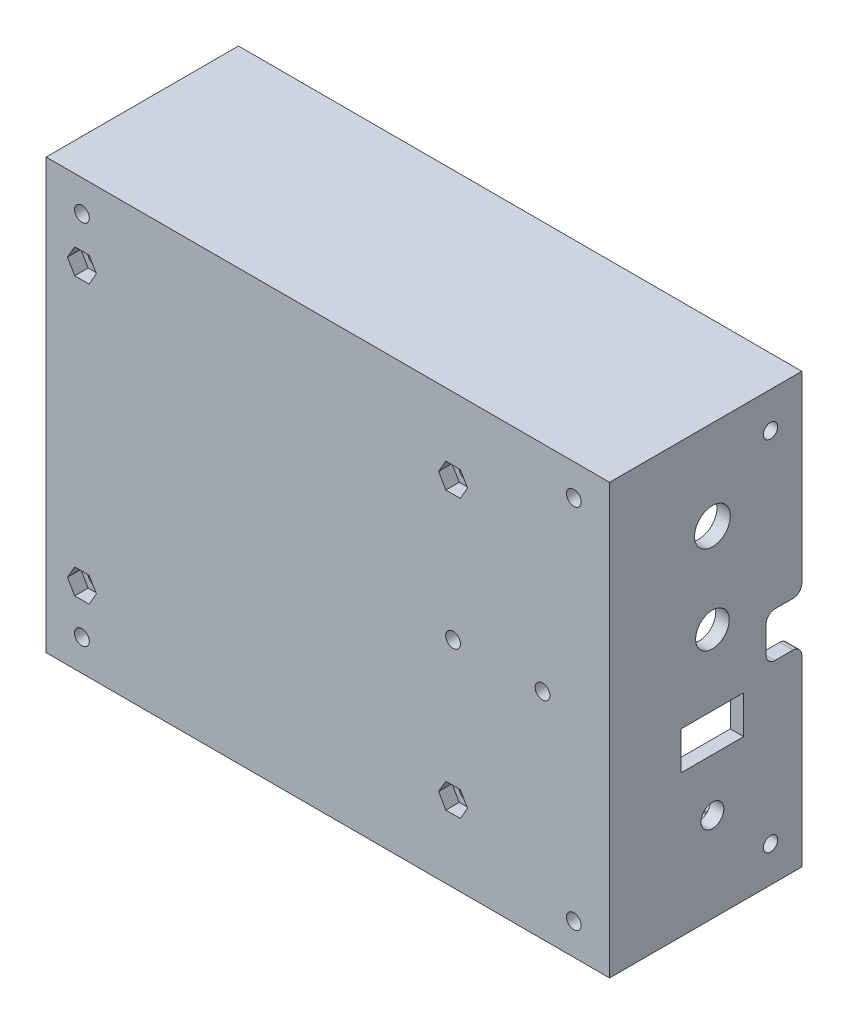
from build123d import *

# Parameters (mm, degrees)
SKETCH1_W            = 120
SKETCH1_H            = 90
SKETCH1_R            = 1.65
BOSS_EXTRUDE2_DEPTH  = 4
SKETCH2_W            = 126
SKETCH2_H            = 96
SKETCH2_W_2          = 120
SKETCH2_H_2          = 90
BOSS_EXTRUDE3_DEPTH  = 43
CUT_EXTRUDE1_REACH   = 142.36
SKETCH3_R            = 1.6
SKETCH4_R            = 3.75
SKETCH4_W            = 8
SKETCH4_H            = 10
SKETCH4_W_2          = 14
SKETCH4_H_2          = 8.5
CUT_EXTRUDE3_DEPTH   = 10
SKETCH5_R            = 4
CUT_EXTRUDE4_DEPTH   = 10
SKETCH6_R            = 2.55
CUT_EXTRUDE5_DEPTH   = 10
SKETCH8_R            = 1.65
CUT_EXTRUDE6_DEPTH   = 10
BOSS_EXTRUDE4_DEPTH  = 3
FILLET1_R            = 2
CUT_EXTRUDE8_DEPTH   = 3
BOSS_EXTRUDE11_START = 5
SKETCH12_R           = 3.5
SKETCH12_R_2         = 1.65
BOSS_EXTRUDE11_DEPTH = 5
SKETCH13_W           = 18
SKETCH13_H           = 16
SKETCH13_W_2         = 12
SKETCH13_H_2         = 12
BOSS_EXTRUDE12_DEPTH = 1
CHAMFER1_SIZE        = 1
SKETCH16_R           = 3.5
CUT_EXTRUDE11_DEPTH  = 3
SKETCH17_W           = 55.5
SKETCH17_H           = 15
CUT_EXTRUDE13_DEPTH  = 2
SKETCH20_W           = 55.5
SKETCH20_H           = 15
CUT_EXTRUDE14_DEPTH  = 2
SKETCH21_W           = 8
SKETCH21_H           = 34.5
SKETCH21_W_2         = 15
SKETCH21_H_2         = 40.5
CUT_EXTRUDE15_DEPTH  = 2
CHAMFER6_SIZE        = 1.5


with BuildPart() as part:
    # Sketch1 → Boss-Extrude2 (new body)
    with BuildSketch(Plane.XY):
        Rectangle(SKETCH1_W, SKETCH1_H)
        with Locations((-55, 31)):
            Circle(SKETCH1_R, mode=Mode.SUBTRACT)
        with Locations((28, 31)):
            Circle(SKETCH1_R, mode=Mode.SUBTRACT)
        with Locations((28, -31)):
            Circle(SKETCH1_R, mode=Mode.SUBTRACT)
        with Locations((-55, -31)):
            Circle(SKETCH1_R, mode=Mode.SUBTRACT)
        with Locations((-55, 41)):
            Circle(SKETCH1_R, mode=Mode.SUBTRACT)
        with Locations((55, 41)):
            Circle(SKETCH1_R, mode=Mode.SUBTRACT)
        with Locations((55, -41)):
            Circle(SKETCH1_R, mode=Mode.SUBTRACT)
        with Locations((-55, -41)):
            Circle(SKETCH1_R, mode=Mode.SUBTRACT)
    extrude(amount=BOSS_EXTRUDE2_DEPTH)

    # Sketch2 → Boss-Extrude3 (add)
    with BuildSketch(Plane.XY.offset(4)):
        Rectangle(SKETCH2_W, SKETCH2_H)
        Rectangle(SKETCH2_W_2, SKETCH2_H_2, mode=Mode.SUBTRACT)
    extrude(amount=-BOSS_EXTRUDE3_DEPTH)

    # Cut-Extrude1: up to this face of the body (flat: up to its plane)
    cut_extrude1_end = Plane(part.part.faces().sort_by_distance((63, 0, -17.5))[0])
    # Sketch3 → Cut-Extrude1 (cut, up to the picked face)
    with BuildSketch(Plane.ZY.offset(63), mode=Mode.PRIVATE) as cut_extrude1_sk1:
        with Locations(Location((-32, -40, 0), (0, 0, 180))):
            Circle(SKETCH3_R)
    cut_extrude1_tool1 = split(extrude(cut_extrude1_sk1.sketch, amount=-CUT_EXTRUDE1_REACH, mode=Mode.PRIVATE), bisect_by=cut_extrude1_end, keep=Keep.BOTH, mode=Mode.PRIVATE)
    # Sketch3 → Cut-Extrude1 (cut, up to the picked face)
    with BuildSketch(Plane.ZY.offset(63), mode=Mode.PRIVATE) as cut_extrude1_sk2:
        with Locations(Location((-32, 40, 0), (0, 0, 180))):
            Circle(SKETCH3_R)
    cut_extrude1_tool2 = split(extrude(cut_extrude1_sk2.sketch, amount=-CUT_EXTRUDE1_REACH, mode=Mode.PRIVATE), bisect_by=cut_extrude1_end, keep=Keep.BOTH, mode=Mode.PRIVATE)
    add(cut_extrude1_tool1.solids().sort_by(Axis((-63, -40, -32), (1, 0, 0)))[0], mode=Mode.SUBTRACT)
    add(cut_extrude1_tool2.solids().sort_by(Axis((-63, 40, -32), (1, 0, 0)))[0], mode=Mode.SUBTRACT)

    # Sketch4 → Cut-Extrude3 (cut)
    with BuildSketch(Plane(origin=(63, 0, 0), x_dir=(0, 0, -1), z_dir=(1, 0, 0))):
        with Locations((19, 8)):
            Circle(SKETCH4_R)
        with Locations((35, 0)):
            Rectangle(SKETCH4_W, SKETCH4_H)
        with Locations((19, -12)):
            Rectangle(SKETCH4_W_2, SKETCH4_H_2)
    extrude(amount=-CUT_EXTRUDE3_DEPTH, mode=Mode.SUBTRACT)

    # Sketch5 → Cut-Extrude4 (cut)
    with BuildSketch(Plane(origin=(63, 0, 0), x_dir=(0, 0, -1), z_dir=(1, 0, 0))):
        with Locations((19, 28)):
            Circle(SKETCH5_R)
    extrude(amount=-CUT_EXTRUDE4_DEPTH, mode=Mode.SUBTRACT)

    # Sketch6 → Cut-Extrude5 (cut)
    with BuildSketch(Plane(origin=(63, 0, 0), x_dir=(0, 0, -1), z_dir=(1, 0, 0))):
        with Locations((19, -28)):
            Circle(SKETCH6_R)
    extrude(amount=-CUT_EXTRUDE5_DEPTH, mode=Mode.SUBTRACT)

    # Sketch8 → Cut-Extrude6 (cut)
    with BuildSketch(Plane(origin=(0, 0, 0), x_dir=(-1, 0, 0), z_dir=(0, 0, -1))):
        with Locations((-48, 0)):
            Circle(SKETCH8_R)
        with Locations((-28, 0)):
            Circle(SKETCH8_R)
    extrude(amount=-CUT_EXTRUDE6_DEPTH, mode=Mode.SUBTRACT)

    # Sketch9 → Boss-Extrude4 (add)
    # profile 1 of 6: a face of its own
    with BuildSketch(Plane(origin=(0, 0, 0), x_dir=(-1, 0, 0), z_dir=(0, 0, -1))):
        Polygon((-45.228718708, 4.8), (-50.771281292, 4.8), (-53.542562584, 0), (-50.771281292, -4.8), (-45.228718708, -4.8), (-42.457437416, 0), align=None)
        Polygon((-46.383419246, 2.8), (-49.616580754, 2.8), (-51.233161507, 0), (-49.616580754, -2.8), (-46.383419246, -2.8), (-44.766838493, 0), align=None, mode=Mode.SUBTRACT)
    # profile 2 of 6: a face of its own
    with BuildSketch(Plane(origin=(0, 0, 0), x_dir=(-1, 0, 0), z_dir=(0, 0, -1))):
        Polygon((-25.228718708, 4.8), (-30.771281292, 4.8), (-33.542562584, 0), (-30.771281292, -4.8), (-25.228718708, -4.8), (-22.457437416, 0), align=None)
        Polygon((-26.383419246, 2.8), (-29.616580754, 2.8), (-31.233161507, 0), (-29.616580754, -2.8), (-26.383419246, -2.8), (-24.766838493, 0), align=None, mode=Mode.SUBTRACT)
    # profile 3 of 6: a face of its own
    with BuildSketch(Plane(origin=(0, 0, 0), x_dir=(-1, 0, 0), z_dir=(0, 0, -1))):
        Polygon((-50.612137954, 41), (-52.806068977, 44.8), (-57.193931023, 44.8), (-59.387862046, 41), (-57.193931023, 37.2), (-52.806068977, 37.2), align=None)
        Polygon((-51.766838493, 41), (-53.383419246, 43.8), (-56.616580754, 43.8), (-58.233161507, 41), (-56.616580754, 38.2), (-53.383419246, 38.2), align=None, mode=Mode.SUBTRACT)
    # profile 4 of 6: a face of its own
    with BuildSketch(Plane(origin=(0, 0, 0), x_dir=(-1, 0, 0), z_dir=(0, 0, -1))):
        Polygon((52.806068977, 44.8), (50.612137954, 41), (52.806068977, 37.2), (57.193931023, 37.2), (59.387862046, 41), (57.193931023, 44.8), align=None)
        Polygon((58.233161507, 41), (56.616580754, 43.8), (53.383419246, 43.8), (51.766838493, 41), (53.383419246, 38.2), (56.616580754, 38.2), align=None, mode=Mode.SUBTRACT)
    # profile 5 of 6: a face of its own
    with BuildSketch(Plane(origin=(0, 0, 0), x_dir=(-1, 0, 0), z_dir=(0, 0, -1))):
        Polygon((50.612137954, -41), (52.806068977, -44.8), (57.193931023, -44.8), (59.387862046, -41), (57.193931023, -37.2), (52.806068977, -37.2), align=None)
        Polygon((53.383419246, -38.2), (51.766838493, -41), (53.383419246, -43.8), (56.616580754, -43.8), (58.233161507, -41), (56.616580754, -38.2), align=None, mode=Mode.SUBTRACT)
    # profile 6 of 6: a face of its own
    with BuildSketch(Plane(origin=(0, 0, 0), x_dir=(-1, 0, 0), z_dir=(0, 0, -1))):
        Polygon((-52.806068977, -37.2), (-57.193931023, -37.2), (-59.387862046, -41), (-57.193931023, -44.8), (-52.806068977, -44.8), (-50.612137954, -41), align=None)
        Polygon((-53.383419246, -38.2), (-56.616580754, -38.2), (-58.233161507, -41), (-56.616580754, -43.8), (-53.383419246, -43.8), (-51.766838493, -41), align=None, mode=Mode.SUBTRACT)
    extrude(amount=BOSS_EXTRUDE4_DEPTH)

    # Fillet1
    fillet1_edges = [part.edges().sort_by_distance(p)[0] for p in [
        (61.5, 5, -39),
        (61.5, -5, -39),
        (61.5, -5, -31),
        (61.5, 5, -31),
    ]]
    fillet(fillet1_edges, radius=FILLET1_R)

    # Sketch10 → Cut-Extrude8 (cut)
    with BuildSketch(Plane.XY.offset(4)):
        Polygon((-51.766838493, 31), (-53.383419246, 33.8), (-56.616580754, 33.8), (-58.233161507, 31), (-56.616580754, 28.2), (-53.383419246, 28.2), align=None)
        Polygon((31.233161507, 31), (29.616580754, 33.8), (26.383419246, 33.8), (24.766838493, 31), (26.383419246, 28.2), (29.616580754, 28.2), align=None)
        Polygon((-51.766838493, -31), (-53.383419246, -28.2), (-56.616580754, -28.2), (-58.233161507, -31), (-56.616580754, -33.8), (-53.383419246, -33.8), align=None)
        Polygon((31.233161507, -31), (29.616580754, -28.2), (26.383419246, -28.2), (24.766838493, -31), (26.383419246, -33.8), (29.616580754, -33.8), align=None)
    extrude(amount=-CUT_EXTRUDE8_DEPTH, mode=Mode.SUBTRACT)

    # Sketch12 → Boss-Extrude11 (add)
    # profile 1 of 4: a face of its own
    with BuildSketch(Plane(origin=(0, 0, 0), x_dir=(-1, 0, 0), z_dir=(0, 0, -1)).offset(BOSS_EXTRUDE11_START)):
        with Locations(Location((-28, -31, 0), (0, 0, 180))):
            Circle(SKETCH12_R)
        with Locations((-28, -31)):
            Circle(SKETCH12_R_2, mode=Mode.SUBTRACT)
    # profile 2 of 4: a face of its own
    with BuildSketch(Plane(origin=(0, 0, 0), x_dir=(-1, 0, 0), z_dir=(0, 0, -1)).offset(BOSS_EXTRUDE11_START)):
        with Locations(Location((55, -31, 0), (0, 0, 180))):
            Circle(SKETCH12_R)
        with Locations((55, -31)):
            Circle(SKETCH12_R_2, mode=Mode.SUBTRACT)
    # profile 3 of 4: a face of its own
    with BuildSketch(Plane(origin=(0, 0, 0), x_dir=(-1, 0, 0), z_dir=(0, 0, -1)).offset(BOSS_EXTRUDE11_START)):
        with Locations(Location((55, 31, 0), (0, 0, 180))):
            Circle(SKETCH12_R)
        with Locations((55, 31)):
            Circle(SKETCH12_R_2, mode=Mode.SUBTRACT)
    # profile 4 of 4: a face of its own
    with BuildSketch(Plane(origin=(0, 0, 0), x_dir=(-1, 0, 0), z_dir=(0, 0, -1)).offset(BOSS_EXTRUDE11_START)):
        with Locations(Location((-28, 31, 0), (0, 0, 180))):
            Circle(SKETCH12_R)
        with Locations((-28, 31)):
            Circle(SKETCH12_R_2, mode=Mode.SUBTRACT)
    extrude(amount=-BOSS_EXTRUDE11_DEPTH)

    # Sketch16 → Cut-Extrude11 (cut)
    # profile 1 of 4: a face of its own
    with BuildSketch(Plane(origin=(0, 0, 0), x_dir=(-1, 0, 0), z_dir=(0, 0, -1))):
        Polygon((-1.5, 42), (-50.612137954, 42), (-50.612137954, 41), (-52.806068977, 37.2), (-57, 37.2), (-57, 4.8), (-24.362693304, 4.8), (-22.457437416, 1.5), (-1.5, 1.5), align=None)
        with Locations((-28, 31)):
            Circle(SKETCH16_R, mode=Mode.SUBTRACT)
    # profile 2 of 4: a face of its own
    with BuildSketch(Plane(origin=(0, 0, 0), x_dir=(-1, 0, 0), z_dir=(0, 0, -1))):
        with BuildLine():
            Line((51.189488223, 42), (1.5, 42))
            Line((1.5, 42), (1.5, 1.5))
            Line((1.5, 1.5), (57, 1.5))
            Line((57, 1.5), (57, 27.5))
            Line((57, 27.5), (54.75, 27.5))
            ThreePointArc((54.75, 27.5), (52.451902961, 28.451902961), (51.5, 30.75))
            Line((51.5, 30.75), (51.5, 39.462177826))
            Line((51.5, 39.462177826), (50.612137954, 41))
            Line((50.612137954, 41), (51.189488223, 42))
        make_face()
    # profile 3 of 4: a face of its own
    with BuildSketch(Plane(origin=(0, 0, 0), x_dir=(-1, 0, 0), z_dir=(0, 0, -1))):
        Polygon((-1.5, -42), (-1.5, -1.5), (-22.457437416, -1.5), (-24.362693304, -4.8), (-57, -4.8), (-57, -37.2), (-52.806068977, -37.2), (-50.612137954, -41), (-50.612137954, -42), align=None)
        with Locations((-28, -31)):
            Circle(SKETCH16_R, mode=Mode.SUBTRACT)
    # profile 4 of 4: a face of its own
    with BuildSketch(Plane(origin=(0, 0, 0), x_dir=(-1, 0, 0), z_dir=(0, 0, -1))):
        with BuildLine():
            Line((57, -1.5), (1.5, -1.5))
            Line((1.5, -1.5), (1.5, -42))
            Line((1.5, -42), (51.189488223, -42))
            Line((51.189488223, -42), (50.612137954, -41))
            Line((50.612137954, -41), (51.5, -39.462177826))
            Line((51.5, -39.462177826), (51.5, -30.75))
            ThreePointArc((51.5, -30.75), (52.451902961, -28.451902961), (54.75, -27.5))
            Line((54.75, -27.5), (57, -27.5))
            Line((57, -27.5), (57, -1.5))
        make_face()
    extrude(amount=-CUT_EXTRUDE11_DEPTH, mode=Mode.SUBTRACT)

    # Sketch17 → Cut-Extrude13 (cut)
    with BuildSketch(Plane.XZ.offset(-45)):
        with Locations((-29.25, -28.5)):
            Rectangle(SKETCH17_W, SKETCH17_H)
        with Locations((-29.25, -10.5)):
            Rectangle(SKETCH17_W, SKETCH17_H)
        with Locations((29.25, -10.5)):
            Rectangle(SKETCH17_W, SKETCH17_H)
        with Locations((29.25, -28.5)):
            Rectangle(SKETCH17_W, SKETCH17_H)
    extrude(amount=-CUT_EXTRUDE13_DEPTH, mode=Mode.SUBTRACT)

    # Sketch20 → Cut-Extrude14 (cut)
    with BuildSketch(Plane(origin=(0, -45, 0), x_dir=(1, 0, 0), z_dir=(0, 1, 0))):
        with Locations((-29.25, 28.5)):
            Rectangle(SKETCH20_W, SKETCH20_H)
        with Locations((29.25, 28.5)):
            Rectangle(SKETCH20_W, SKETCH20_H)
        with Locations((29.25, 10.5)):
            Rectangle(SKETCH20_W, SKETCH20_H)
        with Locations((-29.25, 10.5)):
            Rectangle(SKETCH20_W, SKETCH20_H)
    extrude(amount=-CUT_EXTRUDE14_DEPTH, mode=Mode.SUBTRACT)

    # Sketch21 → Cut-Extrude15 (cut)
    with BuildSketch(Plane(origin=(-60, 0, 0), x_dir=(0, 0, -1), z_dir=(1, 0, 0))):
        with Locations((32, 18.75)):
            Rectangle(SKETCH21_W, SKETCH21_H)
        Polygon((28, 36), (28, 42), (21, 42), (21, 1.5), (28, 1.5), align=None)
        with Locations((32, -18.75)):
            Rectangle(SKETCH21_W, SKETCH21_H)
        Polygon((28, -1.5), (21, -1.5), (21, -42), (28, -42), (28, -36), align=None)
        with Locations((10.5, -21.75)):
            Rectangle(SKETCH21_W_2, SKETCH21_H_2)
        with Locations((10.5, 21.75)):
            Rectangle(SKETCH21_W_2, SKETCH21_H_2)
    extrude(amount=-CUT_EXTRUDE15_DEPTH, mode=Mode.SUBTRACT)

    # Chamfer6
    chamfer6_edges = [part.edges().sort_by_distance(p)[0] for p in [
        (29.25, 47, -36),
        (29.25, 47, -18),
        (-29.25, 47, -18),
        (-29.25, 47, -36),
        (-29.25, -47, -18),
        (29.25, -47, -18),
        (29.25, -47, -36),
        (-29.25, -47, -36),
        (-62, 21.75, -18),
        (-62, -21.75, -18),
        (-62, -18.75, -36),
        (-62, -39, -28),
        (-62, 18.75, -36),
        (-62, 39, -28),
    ]]
    chamfer(chamfer6_edges, length=CHAMFER6_SIZE)


with BuildPart() as body_2:
    # Sketch13 → Boss-Extrude12 (new body)
    with BuildSketch(Plane.ZY.offset(-60)):
        with Locations((-19, 28)):
            Rectangle(SKETCH13_W, SKETCH13_H)
        with Locations((-19, 28)):
            Rectangle(SKETCH13_W_2, SKETCH13_H_2, mode=Mode.SUBTRACT)
    extrude(amount=BOSS_EXTRUDE12_DEPTH)

    # Chamfer1
    chamfer1_edges = [body_2.edges().sort_by_distance(p)[0] for p in [
        (59, 28, -10),
        (59, 28, -28),
    ]]
    chamfer(chamfer1_edges, length=CHAMFER1_SIZE - 0.0001)  # a hair under: the kernel refuses the full size


solid = Compound([part.part, body_2.part])
